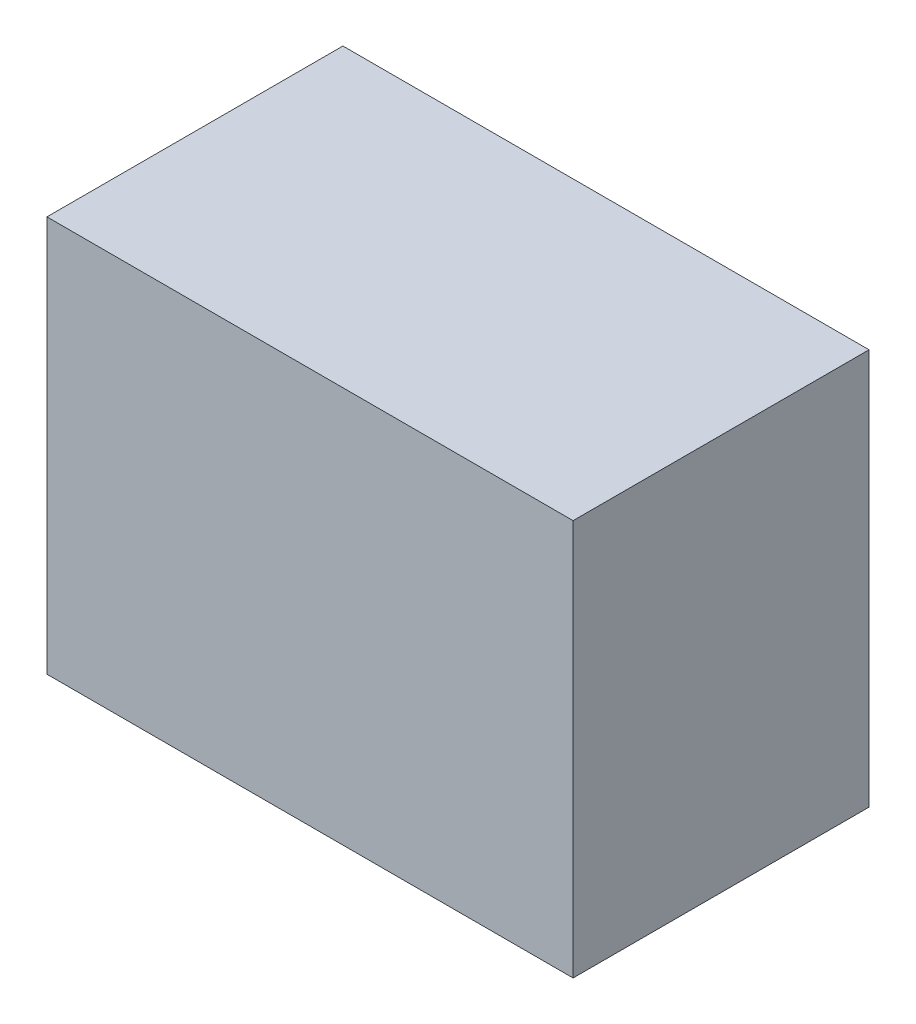
from build123d import *

# Parameters (mm, degrees)
SKETCH1_W           = 390144
SKETCH1_H           = 219456
BOSS_EXTRUDE2_DEPTH = 293710.106


with BuildPart() as part:
    # Sketch1 → Boss-Extrude2 (new body)
    with BuildSketch(Plane(origin=(0, 0, 0), x_dir=(1, 0, 0), z_dir=(0, 1, 0))):
        with Locations((195072, 109728)):
            Rectangle(SKETCH1_W, SKETCH1_H)
    extrude(amount=BOSS_EXTRUDE2_DEPTH)


solid = part.part
